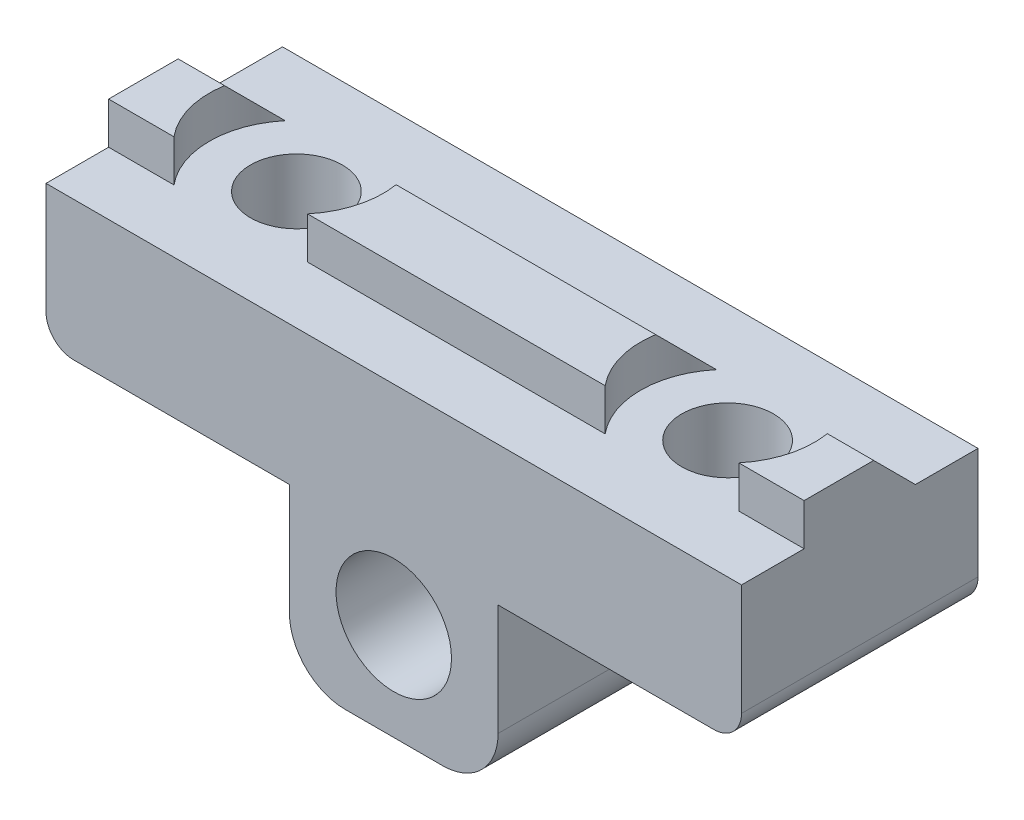
from build123d import *

# Parameters (mm, degrees)
P_IDAT_VYSUNUT_M1_DEPTH                           = 17
V_LCOV_ZAHLOUBEN_PRO_M6_ROUBY_S_HLAVO_D           = 6.6
V_LCOV_ZAHLOUBEN_PRO_M6_ROUBY_S_HLAVO_CBORE_D     = 8.3
V_LCOV_ZAHLOUBEN_PRO_M6_ROUBY_S_HLAVO_CBORE_DEPTH = 10
V_LCOV_ZAHLOUBEN_PRO_M6_ROUBY_S_H_2_D             = 6.6
V_LCOV_ZAHLOUBEN_PRO_M6_ROUBY_S_H_2_CBORE_D       = 12
V_LCOV_ZAHLOUBEN_PRO_M6_ROUBY_S_H_2_CBORE_DEPTH   = 2
ZAOBLIT1_R                                        = 4
P_IDAT_VYSUNUT_M4_DEPTH                           = 3
ZKOSEN_1_SIZE                                     = 3


with BuildPart() as part:
    # Skica1 → Přidat vysunutím1 (new body)
    with BuildSketch(Plane.XY):
        with BuildLine():
            Line((0, 0), (50, 0))
            Line((50, 0), (50, -8))
            ThreePointArc((50, -8), (49.414213562, -9.414213562), (48, -10))
            Line((48, -10), (32.5, -10))
            Line((32.5, -10), (32.5, -22))
            Line((32.5, -22), (17.5, -22))
            Line((17.5, -22), (17.5, -10))
            Line((17.5, -10), (2, -10))
            ThreePointArc((2, -10), (0.585786438, -9.414213562), (0, -8))
            Line((0, -8), (0, 0))
        make_face()
    extrude(amount=P_IDAT_VYSUNUT_M1_DEPTH)

    # V_lcov_ zahlouben_ pro M6 _rouby s hlavo (through all)
    with Locations(Plane.XY.offset(17)):
        with Locations((25, -15)):
            CounterBoreHole(V_LCOV_ZAHLOUBEN_PRO_M6_ROUBY_S_HLAVO_D / 2, V_LCOV_ZAHLOUBEN_PRO_M6_ROUBY_S_HLAVO_CBORE_D / 2, V_LCOV_ZAHLOUBEN_PRO_M6_ROUBY_S_HLAVO_CBORE_DEPTH)

    # V_lcov_ zahlouben_ pro M6 _rouby s h 2 (through all)
    with Locations(Plane(origin=(0, -10, 0), x_dir=(-1, 0, 0), z_dir=(0, -1, 0))):
        with Locations((-9.5, -8.5), (-40.5, -8.5)):
            CounterBoreHole(V_LCOV_ZAHLOUBEN_PRO_M6_ROUBY_S_H_2_D / 2, V_LCOV_ZAHLOUBEN_PRO_M6_ROUBY_S_H_2_CBORE_D / 2, V_LCOV_ZAHLOUBEN_PRO_M6_ROUBY_S_H_2_CBORE_DEPTH)

    # Zaoblit1
    zaoblit1_edges = [part.edges().sort_by_distance(p)[0] for p in [
        (32.5, -22, 8.5),
        (17.5, -22, 8.5),
    ]]
    fillet(zaoblit1_edges, radius=ZAOBLIT1_R)

    # Skica10 → Přidat vysunutím4 (add)
    with BuildSketch(Plane(origin=(0, 0, 0), x_dir=(1, 0, 0), z_dir=(0, 1, 0))):
        with BuildLine():
            Line((15.75, -8.5), (34.25, -8.5))
            ThreePointArc((34.25, -8.5), (34.623047352, -6.373047352), (35.697656822, -4.5))
            Line((35.697656822, -4.5), (14.302343178, -4.5))
            ThreePointArc((14.302343178, -4.5), (15.376952648, -6.373047352), (15.75, -8.5))
        make_face()
        with BuildLine():
            ThreePointArc((35.697656822, -12.5), (34.623047352, -10.626952648), (34.25, -8.5))
            Line((34.25, -8.5), (15.75, -8.5))
            ThreePointArc((15.75, -8.5), (15.376952648, -10.626952648), (14.302343178, -12.5))
            Line((14.302343178, -12.5), (35.697656822, -12.5))
        make_face()
        with BuildLine():
            ThreePointArc((4.697656822, -12.5), (3.623047352, -10.626952648), (3.25, -8.5))
            Line((3.25, -8.5), (0, -8.5))
            Line((0, -8.5), (0, -12.5))
            Line((0, -12.5), (4.697656822, -12.5))
        make_face()
        with BuildLine():
            Line((0, -8.5), (3.25, -8.5))
            ThreePointArc((3.25, -8.5), (3.623047352, -6.373047352), (4.697656822, -4.5))
            Line((4.697656822, -4.5), (0, -4.5))
            Line((0, -4.5), (0, -8.5))
        make_face()
        with BuildLine():
            Line((46.75, -8.5), (50, -8.5))
            Line((50, -8.5), (50, -4.5))
            Line((50, -4.5), (45.302343178, -4.5))
            ThreePointArc((45.302343178, -4.5), (46.376952648, -6.373047352), (46.75, -8.5))
        make_face()
        with BuildLine():
            Line((50, -12.5), (50, -8.5))
            Line((50, -8.5), (46.75, -8.5))
            ThreePointArc((46.75, -8.5), (46.376952648, -10.626952648), (45.302343178, -12.5))
            Line((45.302343178, -12.5), (50, -12.5))
        make_face()
    extrude(amount=P_IDAT_VYSUNUT_M4_DEPTH)

    # Zkosení1
    zkosen_1_edges = [part.edges().sort_by_distance(p)[0] for p in [
        (25, 3, 4.5),
        (2.348828411, 3, 4.5),
        (47.651171589, 3, 4.5),
    ]]
    chamfer(zkosen_1_edges, length=ZKOSEN_1_SIZE - 0.0001)  # a hair under: the kernel refuses the full size


solid = part.part
